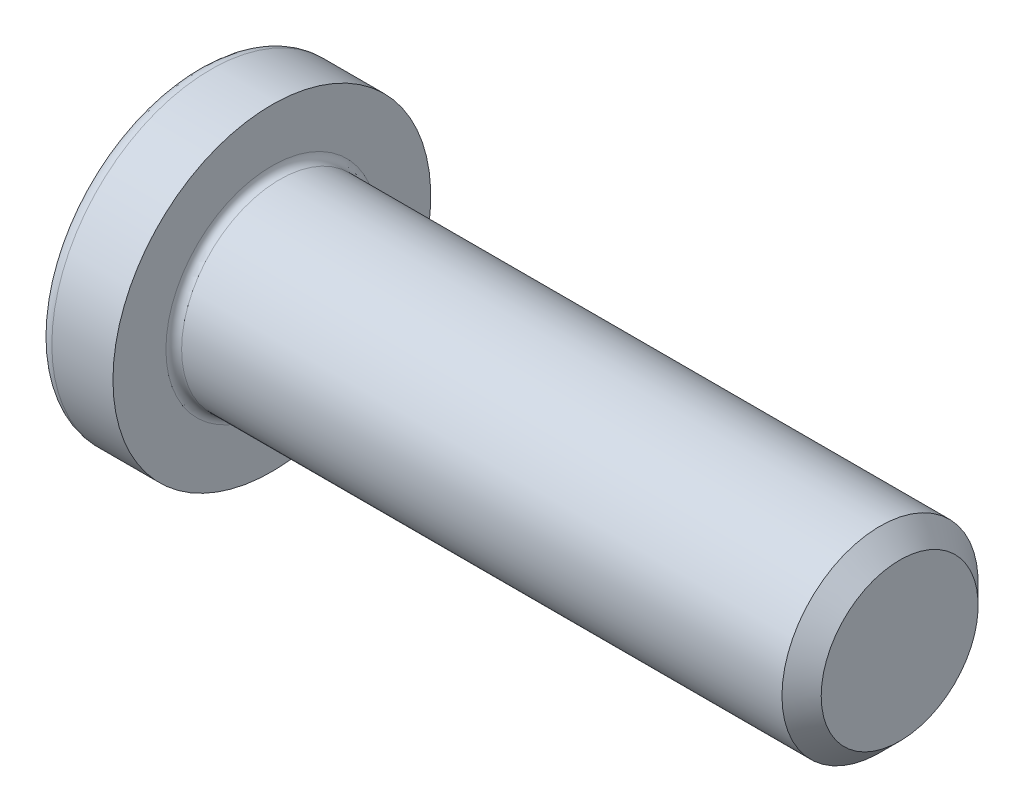
from build123d import *

# Parameters (mm, degrees)
CONG_1_R                             = 0.2
ENL_VEMENT_START                     = -0.515
ENL_VEMENT_DE_MATI_RE_LISSAGE1_DEPTH = 1.03
R_P_TITION_CIRCULAIRE1_COUNT         = 2
R_P_TITION_CIRCULAIRE1_ANGLE         = 90
CHANFREIN1_SIZE                      = 0.5


# Read off the part's stored shape, not the designer's step: Enlèvement de matière-Lissage1
with BuildPart() as part:
    # Esquisse1 → Révolution1 (revolve)
    with BuildSketch(Plane.XY, mode=Mode.PRIVATE) as r_volution1_sk:
        with BuildLine():
            Line((3.15, 2.5), (3.15, 4.05))
            Line((3.15, 4.05), (1.592505731, 4.05))
            ThreePointArc((1.592505731, 4.05), (1.431705614, 4.012092102), (1.304769911, 3.906351792))
            ThreePointArc((1.304769911, 3.906351792), (0.334815673, 2.059247972), (0, 0))
            Line((0, 0), (19.15, 0))
            Line((19.15, 0), (19.15, 2.5))
            Line((19.15, 2.5), (3.15, 2.5))
        make_face()
    revolve(r_volution1_sk.sketch.rotate(Axis((-25.4, 0, 0), (1, 0, 0)), 90), axis=Axis((-25.4, 0, 0), (1, 0, 0)))

    # Congé1
    cong_1_edges = [part.edges().sort_by_distance(p)[0] for p in [
        (3.15, 0, -2.5),
    ]]
    fillet(cong_1_edges, radius=CONG_1_R)

    # Enlèvement de matière-Lissage1 outline → Enlèvement de matière-Lissage1 (cut)
    with BuildSketch(Plane.XY.offset(ENL_VEMENT_START)):
        Polygon((2.34, -0.983319232), (2.34, 0.983319232), (0.349683815, 2.103238481), (-1, 2.862684089), (-1, -2.862684089), (0.349683815, -2.103238481), align=None)
    enl_vement_de_mati_re_lissage1 = extrude(amount=ENL_VEMENT_DE_MATI_RE_LISSAGE1_DEPTH, mode=Mode.SUBTRACT)

    # Répétition circulaire1: Enlèvement de matière-Lissage1 ×2 about axis
    r_p_tition_circulaire1_axis = Axis((0, 0, 0), (-1, 0, 0))
    for i in range(1, R_P_TITION_CIRCULAIRE1_COUNT):
        add(enl_vement_de_mati_re_lissage1.rotate(r_p_tition_circulaire1_axis, i * R_P_TITION_CIRCULAIRE1_ANGLE / (R_P_TITION_CIRCULAIRE1_COUNT - 1)), mode=Mode.SUBTRACT)

    # Esquisse4 → Enlèvement de matière-Révolution1 (revolve, cut)
    with BuildSketch(Plane.XY, mode=Mode.PRIVATE) as enl_vement_de_mati_re_r_volution1_sk:
        Polygon((0, 0), (0, 1.01462874), (2.34, 0.851), (2.616506661, 0), align=None)
    revolve(enl_vement_de_mati_re_r_volution1_sk.sketch.rotate(Axis((-3.175, 0, 0), (1, 0, 0)), 13.8231891), axis=Axis((-3.175, 0, 0), (1, 0, 0)), mode=Mode.SUBTRACT)

    # Chanfrein1
    chanfrein1_edges = [part.edges().sort_by_distance(p)[0] for p in [
        (19.15, 0, -2.5),
    ]]
    chamfer(chanfrein1_edges, length=CHANFREIN1_SIZE)


solid = part.part
